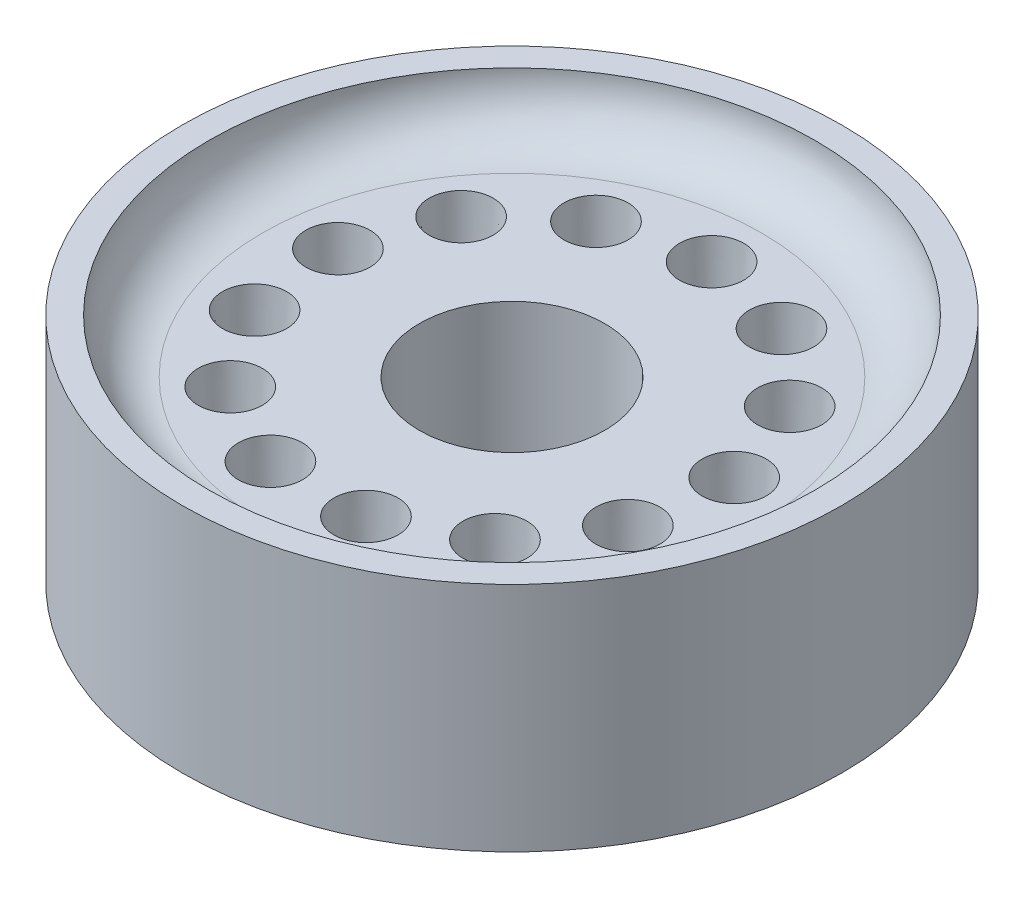
from build123d import *

# Parameters (mm, degrees)
BOSS_EXTRU_1_DEPTH      = 6.5
ESQUISSE6_R             = 2.6
ENL_V_MAT_EXTRU_2_DEPTH = 15.607361158
ESQUISSE7_R             = 8.5
ENL_V_MAT_EXTRU_4_DEPTH = 1.5
CONG_1_R                = 1.5


with BuildPart() as part:
    # Esquisse1 → Boss.-Extru.1 (new body)
    with BuildSketch(Plane(origin=(0, 0, 0), x_dir=(1, 0, 0), z_dir=(0, 1, 0))):
        with BuildLine():
            ThreePointArc((-4.625, -8.010734985), (0, -9.25), (4.625, -8.010734985))
            ThreePointArc((4.625, -8.010734985), (9.25, 0), (4.625, 8.010734985))
            ThreePointArc((4.625, 8.010734985), (0, 9.25), (-4.625, 8.010734985))
            ThreePointArc((-4.625, 8.010734985), (-9.25, 0), (-4.625, -8.010734985))
        make_face()
    extrude(amount=BOSS_EXTRU_1_DEPTH)

    # Esquisse6 → Enlèv. mat.-Extru.2 (cut, through all)
    with BuildSketch(Plane(origin=(0, 6.5, 0), x_dir=(1, 0, 0), z_dir=(0, 1, 0))):
        with Locations(Location((0, 0, 0), (0, 0, 270))):
            Circle(ESQUISSE6_R)
    extrude(amount=-ENL_V_MAT_EXTRU_2_DEPTH, mode=Mode.SUBTRACT)

    # Esquisse7 → Enlèv. mat.-Extru.4 (cut)
    with BuildSketch(Plane(origin=(0, 6.5, 0), x_dir=(1, 0, 0), z_dir=(0, 1, 0))):
        with Locations(Location((0, 0, 0), (0, 0, 270))):
            Circle(ESQUISSE7_R)
    extrude(amount=-ENL_V_MAT_EXTRU_4_DEPTH, mode=Mode.SUBTRACT)

    # Congé1
    cong_1_edges = [part.edges().sort_by_distance(p)[0] for p in [
        (0, 5, -8.5),
    ]]
    fillet(cong_1_edges, radius=CONG_1_R - 0.0001)  # a hair under: the kernel refuses the full size

    # Enlèv. mat.-Extru.3 cone 1 section (through the dimple's axis) → Enlèv. mat.-Extru.3 (revolve, cut)
    with BuildSketch(Plane(origin=(0, 5, -5.6), x_dir=(0, 0, 1), z_dir=(1, 0, 0))):
        Polygon((0, 0), (0.9, 0), (0, 12.870599631), align=None)
    revolve(axis=Axis((0, 5, -5.6), (0, -1, 0)), mode=Mode.SUBTRACT)

    # Enlèv. mat.-Extru.3 cone 2 section (through the dimple's axis) → Enlèv. mat.-Extru.3 cone 2 (revolve, cut)
    with BuildSketch(Plane(origin=(2.602449763, 5, -4.958553744), x_dir=(0, 0, 1), z_dir=(1, 0, 0))):
        Polygon((0, 0), (0.9, 0), (0, 12.870599631), align=None)
    revolve(axis=Axis((2.602449763, 5, -4.958553744), (0, -1, 0)), mode=Mode.SUBTRACT)

    # Enlèv. mat.-Extru.3 cone 3 section (through the dimple's axis) → Enlèv. mat.-Extru.3 cone 3 (revolve, cut)
    with BuildSketch(Plane(origin=(4.608709649, 5, -3.181162582), x_dir=(0, 0, 1), z_dir=(1, 0, 0))):
        Polygon((0, 0), (0.9, 0), (0, 12.870599631), align=None)
    revolve(axis=Axis((4.608709649, 5, -3.181162582), (0, -1, 0)), mode=Mode.SUBTRACT)

    # Enlèv. mat.-Extru.3 cone 4 section (through the dimple's axis) → Enlèv. mat.-Extru.3 cone 4 (revolve, cut)
    with BuildSketch(Plane(origin=(5.559169695, 5, -0.675005409), x_dir=(0, 0, 1), z_dir=(1, 0, 0))):
        Polygon((0, 0), (0.9, 0), (0, 12.870599631), align=None)
    revolve(axis=Axis((5.559169695, 5, -0.675005409), (0, -1, 0)), mode=Mode.SUBTRACT)

    # Enlèv. mat.-Extru.3 cone 5 section (through the dimple's axis) → Enlèv. mat.-Extru.3 cone 5 (revolve, cut)
    with BuildSketch(Plane(origin=(5.236090959, 5, 1.985787367), x_dir=(0, 0, 1), z_dir=(1, 0, 0))):
        Polygon((0, 0), (0.9, 0), (0, 12.870599631), align=None)
    revolve(axis=Axis((5.236090959, 5, 1.985787367), (0, -1, 0)), mode=Mode.SUBTRACT)

    # Enlèv. mat.-Extru.3 cone 6 section (through the dimple's axis) → Enlèv. mat.-Extru.3 cone 6 (revolve, cut)
    with BuildSketch(Plane(origin=(3.713486886, 5, 4.19166019), x_dir=(0, 0, 1), z_dir=(1, 0, 0))):
        Polygon((0, 0), (0.9, 0), (0, 12.870599631), align=None)
    revolve(axis=Axis((3.713486886, 5, 4.19166019), (0, -1, 0)), mode=Mode.SUBTRACT)

    # Enlèv. mat.-Extru.3 cone 7 section (through the dimple's axis) → Enlèv. mat.-Extru.3 cone 7 (revolve, cut)
    with BuildSketch(Plane(origin=(1.34016772, 5, 5.437274178), x_dir=(0, 0, 1), z_dir=(1, 0, 0))):
        Polygon((0, 0), (0.9, 0), (0, 12.870599631), align=None)
    revolve(axis=Axis((1.34016772, 5, 5.437274178), (0, -1, 0)), mode=Mode.SUBTRACT)

    # Enlèv. mat.-Extru.3 cone 8 section (through the dimple's axis) → Enlèv. mat.-Extru.3 cone 8 (revolve, cut)
    with BuildSketch(Plane(origin=(-1.34016772, 5, 5.437274178), x_dir=(0, 0, 1), z_dir=(1, 0, 0))):
        Polygon((0, 0), (0.9, 0), (0, 12.870599631), align=None)
    revolve(axis=Axis((-1.34016772, 5, 5.437274178), (0, -1, 0)), mode=Mode.SUBTRACT)

    # Enlèv. mat.-Extru.3 cone 9 section (through the dimple's axis) → Enlèv. mat.-Extru.3 cone 9 (revolve, cut)
    with BuildSketch(Plane(origin=(-3.713486886, 5, 4.19166019), x_dir=(0, 0, 1), z_dir=(1, 0, 0))):
        Polygon((0, 0), (0.9, 0), (0, 12.870599631), align=None)
    revolve(axis=Axis((-3.713486886, 5, 4.19166019), (0, -1, 0)), mode=Mode.SUBTRACT)

    # Enlèv. mat.-Extru.3 cone 10 section (through the dimple's axis) → Enlèv. mat.-Extru.3 cone 10 (revolve, cut)
    with BuildSketch(Plane(origin=(-5.236090959, 5, 1.985787367), x_dir=(0, 0, 1), z_dir=(1, 0, 0))):
        Polygon((0, 0), (0.9, 0), (0, 12.870599631), align=None)
    revolve(axis=Axis((-5.236090959, 5, 1.985787367), (0, -1, 0)), mode=Mode.SUBTRACT)

    # Enlèv. mat.-Extru.3 cone 11 section (through the dimple's axis) → Enlèv. mat.-Extru.3 cone 11 (revolve, cut)
    with BuildSketch(Plane(origin=(-5.559169695, 5, -0.675005409), x_dir=(0, 0, 1), z_dir=(1, 0, 0))):
        Polygon((0, 0), (0.9, 0), (0, 12.870599631), align=None)
    revolve(axis=Axis((-5.559169695, 5, -0.675005409), (0, -1, 0)), mode=Mode.SUBTRACT)

    # Enlèv. mat.-Extru.3 cone 12 section (through the dimple's axis) → Enlèv. mat.-Extru.3 cone 12 (revolve, cut)
    with BuildSketch(Plane(origin=(-4.608709649, 5, -3.181162582), x_dir=(0, 0, 1), z_dir=(1, 0, 0))):
        Polygon((0, 0), (0.9, 0), (0, 12.870599631), align=None)
    revolve(axis=Axis((-4.608709649, 5, -3.181162582), (0, -1, 0)), mode=Mode.SUBTRACT)

    # Enlèv. mat.-Extru.3 cone 13 section (through the dimple's axis) → Enlèv. mat.-Extru.3 cone 13 (revolve, cut)
    with BuildSketch(Plane(origin=(-2.602449763, 5, -4.958553744), x_dir=(0, 0, 1), z_dir=(1, 0, 0))):
        Polygon((0, 0), (0.9, 0), (0, 12.870599631), align=None)
    revolve(axis=Axis((-2.602449763, 5, -4.958553744), (0, -1, 0)), mode=Mode.SUBTRACT)


solid = part.part
